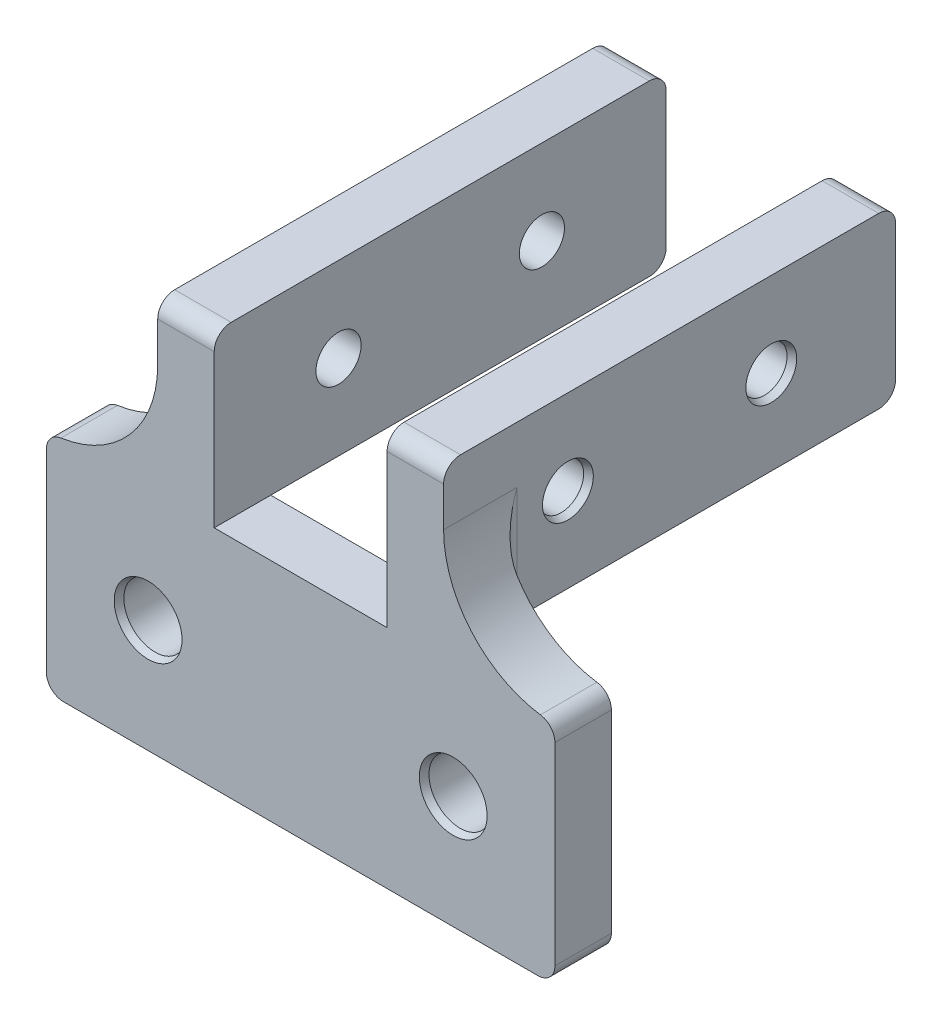
from build123d import *

# Parameters (mm, degrees)
SKETCH1_W                           = 45
SKETCH1_H                           = 20
BOSS_EXTRUDE1_DEPTH                 = 5
BOSS_EXTRUDE2_DEPTH                 = 15
F_4_0_4_DIAMETER_HOLE1_AT_2_COUNT   = 2
F_4_0_4_DIAMETER_HOLE1_AT_2_PITCH   = 18
F_5_5_5_5_DIAMETER_HOLE2_AT_2_COUNT = 2
F_5_5_5_5_DIAMETER_HOLE2_AT_2_PITCH = 27
FILLET1_R                           = 10
FILLET2_R                           = 1.5


with BuildPart() as part:
    # Sketch1 → Boss-Extrude1 (new body)
    with BuildSketch(Plane.XY):
        Rectangle(SKETCH1_W, SKETCH1_H)
    extrude(amount=BOSS_EXTRUDE1_DEPTH)

    # Sketch3 → Boss-Extrude2 (add)
    with BuildSketch(Plane(origin=(0, 10, 0), x_dir=(1, 0, 0), z_dir=(0, 1, 0))):
        Polygon((-7.65, 0), (-7.65, -5), (-12.65, -5), (-12.65, 35), (-7.65, 35), align=None)
        Polygon((7.65, -5), (12.65, -5), (12.65, 35), (7.65, 35), (7.65, 0), align=None)
    extrude(amount=BOSS_EXTRUDE2_DEPTH)

    # Sketch8 → Ø4.0 (4) Diameter Hole1 (revolve, cut)
    with BuildSketch(Plane(origin=(-12.65, 17.5, -24), x_dir=(0, 0, 1), z_dir=(0, 1, 0))):
        Polygon((0, 0), (0, 5), (2, 5), (2, 0.603553391), (2.25, 0), align=None)
    f_4_0_4_diameter_hole1 = revolve(axis=Axis((-19, 17.5, -24), (1, 0, 0)), mode=Mode.SUBTRACT)

    # Ø4.0 (4) Diameter Hole1 at 2: Ø4.0 (4) Diameter Hole1 ×2
    with Locations(*[(0, 0, i * F_4_0_4_DIAMETER_HOLE1_AT_2_PITCH) for i in range(1, F_4_0_4_DIAMETER_HOLE1_AT_2_COUNT)]):
        add(f_4_0_4_diameter_hole1, mode=Mode.SUBTRACT)

    # Mirror3: Ø4.0 (4) Diameter Hole1 across plane
    add(f_4_0_4_diameter_hole1.mirror(Plane(origin=(0, 0, 0), x_dir=(0, 0, 1), z_dir=(1, 0, 0))), mode=Mode.SUBTRACT)

    # Mirror3 copy 1 sketch → Mirror3 copy 1 (revolve, cut)
    with BuildSketch(Plane(origin=(12.65, 17.5, -6), x_dir=(0, 0, 1), z_dir=(0, 1, 0))):
        Polygon((0, 0), (0, -5), (2, -5), (2, -0.603553391), (2.25, 0), align=None)
    revolve(axis=Axis((19, 17.5, -6), (1, 0, 0)), mode=Mode.SUBTRACT)

    # Sketch12 → Ø5.5 (5.5) Diameter Hole2 (revolve, cut)
    with BuildSketch(Plane(origin=(13.5, 0, 5), x_dir=(0, -1, 0), z_dir=(1, 0, 0))):
        Polygon((0, 0), (0, 5), (2.75, 5), (2.75, 0.603553391), (3, 0), align=None)
    f_5_5_5_5_diameter_hole2 = revolve(axis=Axis((13.5, 0, 11.35), (0, 0, -1)), mode=Mode.SUBTRACT)

    # Ø5.5 (5.5) Diameter Hole2 at 2: Ø5.5 (5.5) Diameter Hole2 ×2
    with Locations(*[(-i * F_5_5_5_5_DIAMETER_HOLE2_AT_2_PITCH, 0, 0) for i in range(1, F_5_5_5_5_DIAMETER_HOLE2_AT_2_COUNT)]):
        add(f_5_5_5_5_diameter_hole2, mode=Mode.SUBTRACT)

    # Fillet1
    # the kernel refuses this fillet: 10 mm, written as the material it adds along each edge
    with BuildSketch(Plane(origin=(12.65, 10, 5), x_dir=(1, 0, 0), z_dir=(0, 0, -1))) as fillet1_piece_1:
        with BuildLine():
            CenterArc((10, -9.998874937), FILLET1_R, 90.859468925, 89.140531075)
            Line((0, -9.998874937), (0, 0))
            Line((0, 0), (9.85, 0))
        make_face()
    extrude(amount=5)
    with BuildSketch(Plane(origin=(-12.65, 10, 5), x_dir=(-1, 0, 0), z_dir=(0, 0, -1))) as fillet1_piece_2:
        with BuildLine():
            CenterArc((10, 9.998874937), FILLET1_R, 180, 89.140531075)
            Line((0, 9.998874937), (0, 0))
            Line((0, 0), (9.85, 0))
        make_face()
    extrude(amount=5)

    # Fillet2
    fillet2_edges = [part.edges().sort_by_distance(p)[0] for p in [
        (-10.15, 10, -35),
        (-10.15, 25, -35),
        (-10.15, 25, 5),
        (10.15, 10, -35),
        (10.15, 25, 5),
        (10.15, 25, -35),
        (22.5, -10, 2.5),
        (-22.5, -10, 2.5),
        (-22.5, 10, 2.5),
        (22.5, 10, 2.5),
        (12.65, 14.999437468, 0),
        (-12.65, 14.999437468, 0),
    ]]
    fillet(fillet2_edges, radius=FILLET2_R)


solid = part.part
